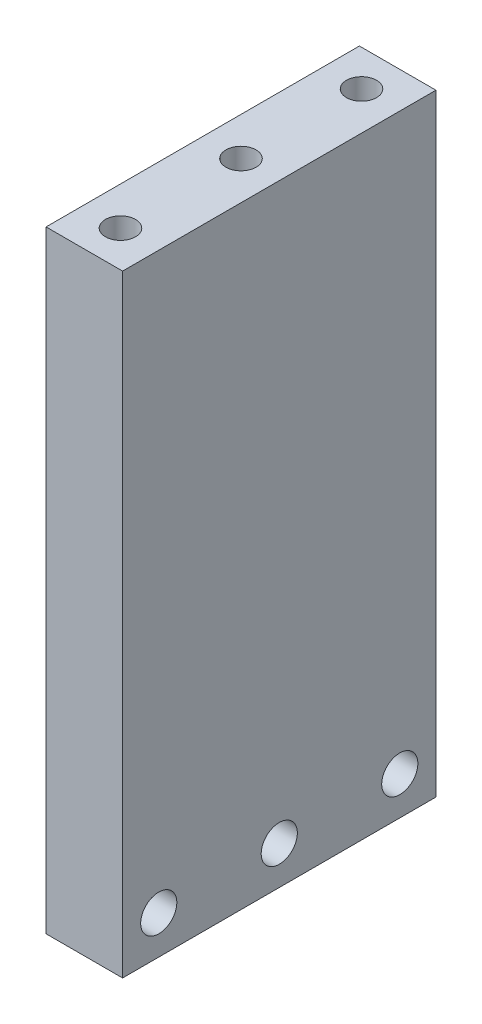
from build123d import *

# Parameters (mm, degrees)
SKETCH1_W           = 6.35
SKETCH1_H           = 50.8
BOSS_EXTRUDE1_DEPTH = 26
SKETCH4_R           = 1.5
CUT_EXTRUDE3_DEPTH  = 6.35
SKETCH5_R           = 1.25
CUT_EXTRUDE4_DEPTH  = 4
SKETCH6_R           = 1.5
CUT_EXTRUDE5_DEPTH  = 6.35
SKETCH7_R           = 1.25
CUT_EXTRUDE6_DEPTH  = 4


with BuildPart() as part:
    # Sketch1 → Boss-Extrude1 (new body)
    with BuildSketch(Plane.XY):
        with Locations((3.175, 25.4)):
            Rectangle(SKETCH1_W, SKETCH1_H)
    extrude(amount=BOSS_EXTRUDE1_DEPTH)

    # Sketch4 → Cut-Extrude3 (cut)
    with BuildSketch(Plane(origin=(6.35, 0, 0), x_dir=(0, 0, -1), z_dir=(1, 0, 0))):
        with Locations((-3, 3.175)):
            Circle(SKETCH4_R)
        with Locations((-23, 3.175)):
            Circle(SKETCH4_R)
    extrude(amount=-CUT_EXTRUDE3_DEPTH, mode=Mode.SUBTRACT)

    # Sketch5 → Cut-Extrude4 (cut)
    with BuildSketch(Plane(origin=(0, 50.8, 0), x_dir=(1, 0, 0), z_dir=(0, 1, 0))):
        with Locations((3.175, -3)):
            Circle(SKETCH5_R)
        with Locations((3.175, -23)):
            Circle(SKETCH5_R)
    extrude(amount=-CUT_EXTRUDE4_DEPTH, mode=Mode.SUBTRACT)

    # Sketch6 → Cut-Extrude5 (cut)
    with BuildSketch(Plane.ZY):
        with Locations((13, 3.175)):
            Circle(SKETCH6_R)
    extrude(amount=-CUT_EXTRUDE5_DEPTH, mode=Mode.SUBTRACT)

    # Sketch7 → Cut-Extrude6 (cut)
    with BuildSketch(Plane(origin=(0, 50.8, 0), x_dir=(1, 0, 0), z_dir=(0, 1, 0))):
        with Locations((3.175, -13)):
            Circle(SKETCH7_R)
    extrude(amount=-CUT_EXTRUDE6_DEPTH, mode=Mode.SUBTRACT)


solid = part.part
